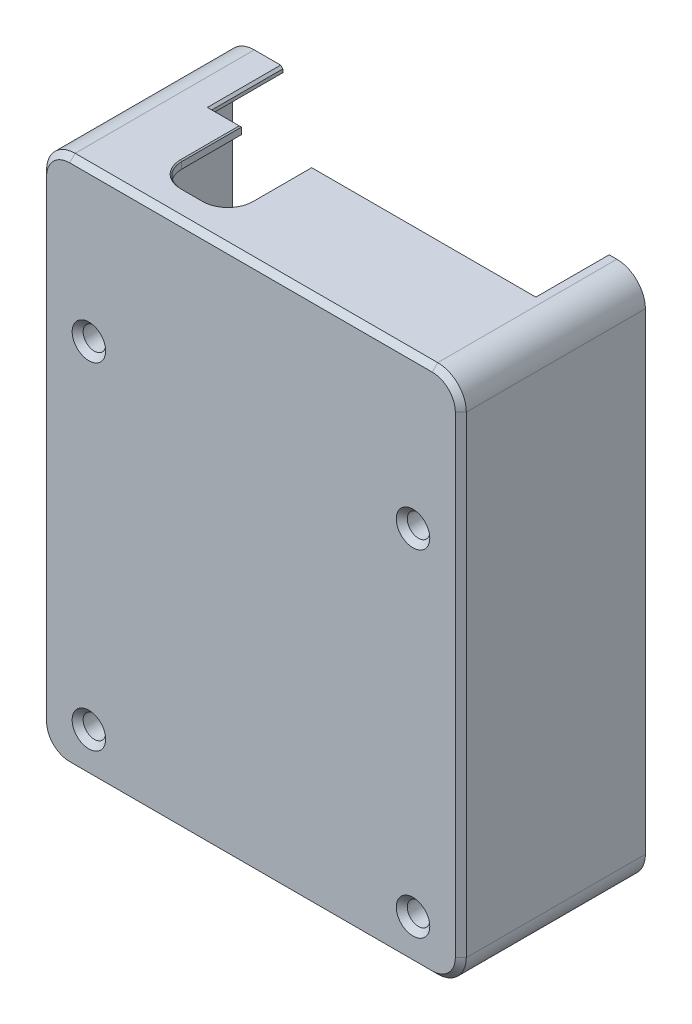
from build123d import *

# Parameters (mm, degrees)
SKETCH_1_R              = 2.25
EXTRUDE_1_DEPTH         = 13.5
EXTRUDE_1_2_DEPTH       = 13.5
EXTRUDE_1_3_DEPTH       = 13.5
EXTRUDE_2_DEPTH         = 1.57
EXTRUDE_3_DEPTH         = 0.8
EXTRUDE_4_DEPTH         = 13.5
SKETCH_19_W             = 26
SKETCH_19_H             = 14
CUT_EXTRUDE_2_DEPTH     = 1.7
SKETCH_20_W             = 29.5
SKETCH_20_H             = 10
CUT_EXTRUDE_3_DEPTH     = 4.7
MOVE_START              = 13.5
MOVE_FACE_4_DEPTH       = 0.93
EXTRUDE_5_DEPTH         = 0.7
M2_5X0_451_D            = 2.05
M2_5X0_451_CSINK_D      = 2.55
M2_5X0_451_CSINK_ANGLE  = 90
CUT_EXTRUDE_4_DEPTH     = 26
CHAMFER_5_SIZE          = 0.2
CHAMFER_1_SIZE          = 0.1
CHAMFER_2_SIZE          = 0.2
EXTRUDE_6_DEPTH         = 2.5
HOLE_WIZARD_M2_51_D     = 2.05
HOLE_WIZARD_M2_51_DEPTH = 7.25
HOLE_WIZARD_M2_51_TIP   = 0.615882135
CHAMFER_3_SIZE          = 0.5
CHAMFER_4_SIZE          = 0.5
CHAMFER_7_SIZE          = 0.2


# Read off the part's stored shape, not the designer's step: Переместить грань4
with BuildPart() as part:
    # Эскиз1 → Бобышка-Вытянуть1 (new body)
    with BuildSketch(Plane.XY):
        Circle(SKETCH_1_R)
    extrude(amount=EXTRUDE_1_DEPTH)



with BuildPart() as body_2:
    # Эскиз1 → Extrude 1 2 (new body)
    with BuildSketch(Plane.XY):
        with Locations((-29.5, 0)):
            Circle(SKETCH_1_R)
    extrude(amount=EXTRUDE_1_2_DEPTH)


with BuildPart() as body_3:
    # Эскиз1 → Extrude 1 3 (new body)
    with BuildSketch(Plane.XY):
        with Locations((-29.5, 30.6)):
            Circle(SKETCH_1_R)
    extrude(amount=EXTRUDE_1_3_DEPTH)


with BuildPart() as body_4:
    # Эскиз2 → Бобышка-Вытянуть2 (new body)
    with BuildSketch(Plane.XY.offset(-0.8)):
        with BuildLine():
            Line((-31.25, -3.9), (1.75, -3.9))
            ThreePointArc((1.75, -3.9), (3.588477631, -3.138477631), (4.35, -1.3))
            Line((4.35, -1.3), (4.35, 41.7))
            ThreePointArc((4.35, 41.7), (3.588477631, 43.538477631), (1.75, 44.3))
            Line((1.75, 44.3), (-31.25, 44.3))
            ThreePointArc((-31.25, 44.3), (-33.088477631, 43.538477631), (-33.85, 41.7))
            Line((-33.85, 41.7), (-33.85, -1.3))
            ThreePointArc((-33.85, -1.3), (-33.088477631, -3.138477631), (-31.25, -3.9))
        make_face()
        with BuildLine():
            Line((-33.15, 41.7), (-33.15, -1.3))
            ThreePointArc((-33.15, -1.3), (-32.593502884, -2.643502884), (-31.25, -3.2))
            Line((-31.25, -3.2), (1.75, -3.2))
            ThreePointArc((1.75, -3.2), (3.093502884, -2.643502884), (3.65, -1.3))
            Line((3.65, -1.3), (3.65, 41.7))
            ThreePointArc((3.65, 41.7), (3.093502884, 43.043502884), (1.75, 43.6))
            Line((1.75, 43.6), (-31.25, 43.6))
            ThreePointArc((-31.25, 43.6), (-32.593502884, 43.043502884), (-33.15, 41.7))
        make_face(mode=Mode.SUBTRACT)
    extrude(amount=-EXTRUDE_2_DEPTH)

    # Эскиз3 → Бобышка-Вытянуть3 (add)
    with BuildSketch(Plane.XY.offset(-0.8)):
        with BuildLine():
            Line((-31.25, -3.9), (1.75, -3.9))
            ThreePointArc((1.75, -3.9), (3.588477631, -3.138477631), (4.35, -1.3))
            Line((4.35, -1.3), (4.35, 41.7))
            ThreePointArc((4.35, 41.7), (3.588477631, 43.538477631), (1.75, 44.3))
            Line((1.75, 44.3), (-31.25, 44.3))
            ThreePointArc((-31.25, 44.3), (-33.088477631, 43.538477631), (-33.85, 41.7))
            Line((-33.85, 41.7), (-33.85, -1.3))
            ThreePointArc((-33.85, -1.3), (-33.088477631, -3.138477631), (-31.25, -3.9))
        make_face()
        with BuildLine():
            Line((1.75, 43.6), (-31.25, 43.6))
            ThreePointArc((-31.25, 43.6), (-32.593502884, 43.043502884), (-33.15, 41.7))
            Line((-33.15, 41.7), (-33.15, -1.3))
            ThreePointArc((-33.15, -1.3), (-32.593502884, -2.643502884), (-31.25, -3.2))
            Line((-31.25, -3.2), (1.75, -3.2))
            ThreePointArc((1.75, -3.2), (3.093502884, -2.643502884), (3.65, -1.3))
            Line((3.65, -1.3), (3.65, 41.7))
            ThreePointArc((3.65, 41.7), (3.093502884, 43.043502884), (1.75, 43.6))
        make_face(mode=Mode.SUBTRACT)
    extrude(amount=EXTRUDE_3_DEPTH)


with BuildPart() as part_1:
    add(part.part)

    add(body_2.part)  # Бобышка-Вытянуть4 merges body 2

    add(body_3.part)  # Бобышка-Вытянуть4 merges body 3

    add(body_4.part)  # Бобышка-Вытянуть4 merges body 4
    # Эскиз5 → Бобышка-Вытянуть4 (add)
    # profile 1 of 4: a face of its own
    with BuildSketch(Plane.XY):
        with BuildLine():
            ThreePointArc((-31.25, 44.3), (-33.088477631, 43.538477631), (-33.85, 41.7))
            Line((-33.85, 41.7), (-33.85, -1.3))
            ThreePointArc((-33.85, -1.3), (-33.088477631, -3.138477631), (-31.25, -3.9))
            Line((-31.25, -3.9), (1.75, -3.9))
            ThreePointArc((1.75, -3.9), (3.588477631, -3.138477631), (4.35, -1.3))
            Line((4.35, -1.3), (4.35, 41.7))
            ThreePointArc((4.35, 41.7), (3.588477631, 43.538477631), (1.75, 44.3))
            Line((1.75, 44.3), (-31.25, 44.3))
        make_face()
        with BuildLine():
            Line((-33.15, -1.3), (-33.15, 41.7))
            ThreePointArc((-33.15, 41.7), (-32.593502884, 43.043502884), (-31.25, 43.6))
            Line((-31.25, 43.6), (1.75, 43.6))
            ThreePointArc((1.75, 43.6), (3.093502884, 43.043502884), (3.65, 41.7))
            Line((3.65, 41.7), (3.65, -1.3))
            ThreePointArc((3.65, -1.3), (3.093502884, -2.643502884), (1.75, -3.2))
            Line((1.75, -3.2), (-31.25, -3.2))
            ThreePointArc((-31.25, -3.2), (-32.593502884, -2.643502884), (-33.15, -1.3))
        make_face(mode=Mode.SUBTRACT)
    # profile 2 of 4: a face of its own
    with BuildSketch(Plane.XY):
        with BuildLine():
            ThreePointArc((-31.334615385, 1.30256915), (-32.45382181, 0.928759898), (-33.15, 1.881488772))
            Line((-33.15, 1.881488772), (-33.15, -1.3))
            ThreePointArc((-33.15, -1.3), (-32.593502884, -2.643502884), (-31.25, -3.2))
            Line((-31.25, -3.2), (-27.107825257, -3.2))
            ThreePointArc((-27.107825257, -3.2), (-28.023500712, -2.601918476), (-27.843879024, -1.523076923))
            ThreePointArc((-27.843879024, -1.523076923), (-30.915639077, -1.74884705), (-31.334615385, 1.30256915))
        make_face()
    # profile 3 of 4: a face of its own
    with BuildSketch(Plane.XY):
        with BuildLine():
            ThreePointArc((-1.656120976, -1.523076923), (-1.476499288, -2.601918476), (-2.392174743, -3.2))
            Line((-2.392174743, -3.2), (1.75, -3.2))
            ThreePointArc((1.75, -3.2), (3.093502884, -2.643502884), (3.65, -1.3))
            Line((3.65, -1.3), (3.65, 1.881488772))
            ThreePointArc((3.65, 1.881488772), (2.95382181, 0.928759898), (1.834615385, 1.30256915))
            ThreePointArc((1.834615385, 1.30256915), (2.143639967, 0.683599073), (2.25, 0))
            ThreePointArc((2.25, 0), (0.817382348, -2.096279108), (-1.656120976, -1.523076923))
        make_face()
    # profile 4 of 4: a face of its own
    with BuildSketch(Plane.XY):
        with BuildLine():
            Line((-33.15, 32.481488772), (-33.15, 28.718511228))
            ThreePointArc((-33.15, 28.718511228), (-32.45382181, 29.671240102), (-31.334615385, 29.29743085))
            ThreePointArc((-31.334615385, 29.29743085), (-31.75, 30.6), (-31.334615385, 31.90256915))
            ThreePointArc((-31.334615385, 31.90256915), (-32.45382181, 31.528759898), (-33.15, 32.481488772))
        make_face()
    extrude(amount=EXTRUDE_4_DEPTH)

    # Эскиз19 → Вырез-Вытянуть2 (cut)
    with BuildSketch(Plane.XZ.offset(3.9)):
        with Locations((-14.797088434, -2.37)):
            Rectangle(SKETCH_19_W, SKETCH_19_H)
    extrude(amount=-CUT_EXTRUDE_2_DEPTH, mode=Mode.SUBTRACT)

    # Эскиз20 → Вырез-Вытянуть3 (cut)
    with BuildSketch(Plane(origin=(0, 44.3, 0), x_dir=(1, 0, 0), z_dir=(0, 1, 0))):
        with Locations((-13.899030762, 0.8)):
            Rectangle(SKETCH_20_W, SKETCH_20_H)
    extrude(amount=-CUT_EXTRUDE_3_DEPTH, mode=Mode.SUBTRACT)

    # Move Face 4 outline → Move Face 4 (add)
    with BuildSketch(Plane.XY.offset(MOVE_START)):
        with BuildLine():
            Line((-33.85, 41.7), (-33.85, -1.3))
            ThreePointArc((-33.85, -1.3), (-33.088477631, -3.138477631), (-31.25, -3.9))
            Line((-31.25, -3.9), (1.75, -3.9))
            ThreePointArc((1.75, -3.9), (3.588477631, -3.138477631), (4.35, -1.3))
            Line((4.35, -1.3), (4.35, 41.7))
            ThreePointArc((4.35, 41.7), (3.588477631, 43.538477631), (1.75, 44.3))
            Line((1.75, 44.3), (-31.25, 44.3))
            ThreePointArc((-31.25, 44.3), (-33.088477631, 43.538477631), (-33.85, 41.7))
        make_face()
        with BuildLine():
            ThreePointArc((-31.334615385, 31.90256915), (-32.45382181, 31.528759898), (-33.15, 32.481488772))
            Line((-33.15, 32.481488772), (-33.15, 41.7))
            ThreePointArc((-33.15, 41.7), (-32.593502884, 43.043502884), (-31.25, 43.6))
            Line((-31.25, 43.6), (1.75, 43.6))
            ThreePointArc((1.75, 43.6), (3.093502884, 43.043502884), (3.65, 41.7))
            Line((3.65, 41.7), (3.65, 1.881488772))
            ThreePointArc((3.65, 1.881488772), (2.95382181, 0.928759898), (1.834615385, 1.30256915))
            ThreePointArc((1.834615385, 1.30256915), (-1.415639077, 1.74884705), (-1.656120976, -1.523076923))
            ThreePointArc((-1.656120976, -1.523076923), (-1.476499288, -2.601918476), (-2.392174743, -3.2))
            Line((-2.392174743, -3.2), (-27.107825257, -3.2))
            ThreePointArc((-27.107825257, -3.2), (-28.023500712, -2.601918476), (-27.843879024, -1.523076923))
            ThreePointArc((-27.843879024, -1.523076923), (-28.084360923, 1.74884705), (-31.334615385, 1.30256915))
            ThreePointArc((-31.334615385, 1.30256915), (-32.45382181, 0.928759898), (-33.15, 1.881488772))
            Line((-33.15, 1.881488772), (-33.15, 28.718511228))
            ThreePointArc((-33.15, 28.718511228), (-32.45382181, 29.671240102), (-31.334615385, 29.29743085))
            ThreePointArc((-31.334615385, 29.29743085), (-27.25, 30.6), (-31.334615385, 31.90256915))
        make_face(mode=Mode.SUBTRACT)
    extrude(amount=MOVE_FACE_4_DEPTH)

    # Эскиз25 → Бобышка-Вытянуть5 (add)
    with BuildSketch(Plane.XY.offset(14.43)):
        with BuildLine():
            Line((-33.85, 41.7), (-33.85, -1.3))
            ThreePointArc((-33.85, -1.3), (-33.088477631, -3.138477631), (-31.25, -3.9))
            Line((-31.25, -3.9), (1.75, -3.9))
            ThreePointArc((1.75, -3.9), (3.588477631, -3.138477631), (4.35, -1.3))
            Line((4.35, -1.3), (4.35, 41.7))
            ThreePointArc((4.35, 41.7), (3.588477631, 43.538477631), (1.75, 44.3))
            Line((1.75, 44.3), (-31.25, 44.3))
            ThreePointArc((-31.25, 44.3), (-33.088477631, 43.538477631), (-33.85, 41.7))
        make_face()
    extrude(amount=-EXTRUDE_5_DEPTH)

    # Отверстие обработанное метчиком M2.5x0.451 (through all)
    with Locations(Plane(origin=(0, 0, 0), x_dir=(-1, 0, 0), z_dir=(0, 0, -1))):
        with Locations((0, 0), (29.5, 0), (29.5, 30.6)):
            CounterSinkHole(M2_5X0_451_D / 2, M2_5X0_451_CSINK_D / 2, counter_sink_angle=M2_5X0_451_CSINK_ANGLE)

    # Эскиз29 → Вырез-Вытянуть4 (cut)
    with BuildSketch(Plane(origin=(0, 44.3, 0), x_dir=(1, 0, 0), z_dir=(0, 1, 0))):
        with BuildLine():
            Line((-21.65, -11.83), (-23.65, -11.83))
            ThreePointArc((-23.65, -11.83), (-25.205634919, -11.185634919), (-25.85, -9.63))
            Line((-25.85, -9.63), (-25.85, -4.2))
            Line((-25.85, -4.2), (-19.45, -4.2))
            Line((-19.45, -4.2), (-19.45, -9.63))
            ThreePointArc((-19.45, -9.63), (-20.094365081, -11.185634919), (-21.65, -11.83))
        make_face()
    extrude(amount=-CUT_EXTRUDE_4_DEPTH, mode=Mode.SUBTRACT)

    # Фаска5
    chamfer_5_edges = [part_1.edges().sort_by_distance(p)[0] for p in [
        (-1.797088434, -3.9, 1.13),
        (-27.797088434, -3.9, 1.13),
        (-28.649030762, 43.6, 0.915),
        (0.850969238, 43.6, 0.915),
        (-28.649030762, 44.3, 0.915),
        (0.850969238, 44.3, 0.915),
    ]]
    chamfer(chamfer_5_edges, length=CHAMFER_5_SIZE)

    # Фаска1
    chamfer_1_edges = [part_1.edges().sort_by_distance(p)[0] for p in [
        (3.093502884, 43.043502884, -2.37),
        (3.65, 20.2, -2.37),
        (3.093502884, -2.643502884, -2.37),
        (-0.023544217, -3.2, -2.37),
        (1.400484619, 43.6, -2.37),
        (-29.523544217, -3.2, -2.37),
        (-32.593502884, -2.643502884, -2.37),
        (-33.15, 20.2, -2.37),
        (-32.593502884, 43.043502884, -2.37),
        (-30.049515381, 43.6, -2.37),
        (-27.349515381, 44.3, 4.2),
        (-25.85, 44.3, 6.915),
        (-25.205634919, 44.3, 11.185634919),
        (-22.65, 44.3, 11.83),
        (-20.094365081, 44.3, 11.185634919),
        (-19.45, 44.3, 6.915),
        (-9.199515381, 44.3, 4.2),
        (-14.797088434, -3.9, 4.63),
        (-27.797088434, -3.2, -1.185),
        (-1.797088434, -3.2, -1.185),
    ]]
    chamfer(chamfer_1_edges, length=CHAMFER_1_SIZE)

    # Фаска2
    # the kernel refuses this chamfer: 0.2 mm, written as the material it takes off along each edge
    with BuildSketch(Plane(origin=(-32.15, 1.881488772, 0), x_dir=(0.8153846153846122, -0.5789196222223671, 0), z_dir=(0.5789196222223671, 0.8153846153846122, 0))) as chamfer_2_piece_1_section:
        Polygon((1, -CHAMFER_2_SIZE), (1 + CHAMFER_2_SIZE, 0), (1, 0), align=None)
    chamfer_2_piece_1 = revolve(axis=Axis((-32.15, 1.881488772, 0), (0, 0, -1)), revolution_arc=174.125308708, mode=Mode.PRIVATE)
    chamfer_2_piece_1 = split(chamfer_2_piece_1, bisect_by=Plane(origin=(-33.15, 0.835809247, 0.097562569), z_dir=(1, 0, 0)), keep=Keep.TOP, mode=Mode.PRIVATE)
    add(chamfer_2_piece_1, mode=Mode.SUBTRACT)
    with BuildSketch(Plane(origin=(-32.15, 28.718511228, 0), x_dir=(-0.8703565626431264, -0.4924220282075544, 0), z_dir=(0.4924220282075544, -0.8703565626431264, 0))) as chamfer_2_piece_2_section:
        Polygon((1, -CHAMFER_2_SIZE), (1 + CHAMFER_2_SIZE, 0), (1, 0), align=None)
    chamfer_2_piece_2 = revolve(axis=Axis((-32.15, 28.718511228, 0), (0, 0, -1)), revolution_arc=174.125308708, mode=Mode.PRIVATE)
    chamfer_2_piece_2 = split(chamfer_2_piece_2, bisect_by=Plane(origin=(-33.15, 29.764190781, 0.097562571), z_dir=(1, 0, 0)), keep=Keep.TOP, mode=Mode.PRIVATE)
    add(chamfer_2_piece_2, mode=Mode.SUBTRACT)
    with BuildSketch(Plane(origin=(-32.15, 32.481488772, 0), x_dir=(0.8153846153846069, -0.5789196222223744, 0), z_dir=(0.5789196222223744, 0.8153846153846069, 0))) as chamfer_2_piece_3_section:
        Polygon((1 + CHAMFER_2_SIZE, 0), (1, -CHAMFER_2_SIZE), (1, 0), align=None)
    chamfer_2_piece_3 = revolve(axis=Axis((-32.15, 32.481488772, 0), (0, 0, -1)), revolution_arc=174.125308708, mode=Mode.PRIVATE)
    chamfer_2_piece_3 = split(chamfer_2_piece_3, bisect_by=Plane(origin=(-33.15, 31.724660289, 0.056714395), z_dir=(1, 0, 0)), keep=Keep.TOP, mode=Mode.PRIVATE)
    add(chamfer_2_piece_3, mode=Mode.SUBTRACT)
    with BuildSketch(Plane(origin=(-2.392174743, -2.2, 0), x_dir=(0.73605376700958, 0.6769230769230777, 0), z_dir=(-0.6769230769230777, 0.73605376700958, 0))) as chamfer_2_piece_4:
        Polygon((1, -CHAMFER_2_SIZE), (1 + CHAMFER_2_SIZE, 0), (1, 0), align=None)
    revolve(axis=Axis((-2.392174743, -2.2, 0), (0, 0, -1)), revolution_arc=125.567691414, mode=Mode.SUBTRACT)
    with BuildSketch(Plane(origin=(-27.107825257, -2.2, 0), x_dir=(-0.24346114137000507, -0.9699106518864582, 0), z_dir=(0.9699106518864582, -0.24346114137000507, 0))) as chamfer_2_piece_5:
        Polygon((1 + CHAMFER_2_SIZE, 0), (1, -CHAMFER_2_SIZE), (1, 0), align=None)
    revolve(axis=Axis((-27.107825257, -2.2, 0), (0, 0, -1)), revolution_arc=118.512756614, mode=Mode.SUBTRACT)
    with BuildSketch(Plane(origin=(0, 0, 0), x_dir=(0.8153846153846158, 0.5789196222223618, 0), z_dir=(0.5789196222223618, -0.8153846153846158, 0))) as chamfer_2_piece_6:
        Polygon((2.25, CHAMFER_2_SIZE), (2.25 - CHAMFER_2_SIZE, 0), (2.25, 0), align=None)
    revolve(axis=Axis((0, 0, 0), (0, 0, 1)), revolution_arc=187.229076359, mode=Mode.SUBTRACT)
    with BuildSketch(Plane(origin=(2.65, 1.881488772, 0), x_dir=(0.8703565626431259, 0.4924220282075555, 0), z_dir=(-0.4924220282075555, 0.8703565626431259, 0))) as chamfer_2_piece_7_section:
        Polygon((1, -CHAMFER_2_SIZE), (1 + CHAMFER_2_SIZE, 0), (1, 0), align=None)
    chamfer_2_piece_7 = revolve(axis=Axis((2.65, 1.881488772, 0), (0, 0, -1)), revolution_arc=174.125308708, mode=Mode.PRIVATE)
    chamfer_2_piece_7 = split(chamfer_2_piece_7, bisect_by=Plane(origin=(3.65, 0.835809234, 0.097562579), z_dir=(-1, 0, 0)), keep=Keep.TOP, mode=Mode.PRIVATE)
    add(chamfer_2_piece_7, mode=Mode.SUBTRACT)
    with BuildSketch(Plane(origin=(-29.5, 0, 0), x_dir=(0.7360537670095794, -0.6769230769230783, 0), z_dir=(-0.6769230769230783, -0.7360537670095794, 0))) as chamfer_2_piece_8:
        Polygon((2.25, CHAMFER_2_SIZE), (2.25 - CHAMFER_2_SIZE, 0), (2.25, 0), align=None)
    revolve(axis=Axis((-29.5, 0, 0), (0, 0, 1)), revolution_arc=187.229076359, mode=Mode.SUBTRACT)
    with BuildSketch(Plane(origin=(-29.5, 30.6, 0), x_dir=(-0.8153846153846124, -0.5789196222223667, 0), z_dir=(-0.5789196222223667, 0.8153846153846124, 0))) as chamfer_2_piece_9:
        Polygon((2.25, CHAMFER_2_SIZE), (2.25 - CHAMFER_2_SIZE, 0), (2.25, 0), align=None)
    revolve(axis=Axis((-29.5, 30.6, 0), (0, 0, 1)), revolution_arc=289.250819106, mode=Mode.SUBTRACT)

    # Эскиз26 → Бобышка-Вытянуть6 (add)
    with BuildSketch(Plane(origin=(0, 0, 13.73), x_dir=(-1, 0, 0), z_dir=(0, 0, -1))):
        with BuildLine():
            Line((-3.65, 32.481488772), (-3.65, 28.718511228))
            ThreePointArc((-3.65, 28.718511228), (-2.95382181, 29.671240102), (-1.834615385, 29.29743085))
            ThreePointArc((-1.834615385, 29.29743085), (2.25, 30.6), (-1.834615385, 31.90256915))
            ThreePointArc((-1.834615385, 31.90256915), (-2.95382181, 31.528759898), (-3.65, 32.481488772))
        make_face()
    extrude(amount=EXTRUDE_6_DEPTH)

    # Отверстие обработанное метчиком M2.51
    with Locations(Plane.XY.offset(14.43)):
        with Locations((0, 30.6)):
            Hole(HOLE_WIZARD_M2_51_D / 2, depth=HOLE_WIZARD_M2_51_DEPTH)
            with Locations((0, 0, -(HOLE_WIZARD_M2_51_DEPTH + HOLE_WIZARD_M2_51_TIP / 2))):  # 118° drill point
                Cone(0, HOLE_WIZARD_M2_51_D / 2, HOLE_WIZARD_M2_51_TIP, mode=Mode.SUBTRACT)

    # Фаска3
    chamfer_3_edges = [part_1.edges().sort_by_distance(p)[0] for p in [
        (-30.525, 30.6, 14.43),
        (-30.525, 0, 14.43),
        (-1.025, 0, 14.43),
        (1.025, 30.6, 14.43),
    ]]
    chamfer(chamfer_3_edges, length=CHAMFER_3_SIZE)

    # Фаска4
    chamfer_4_edges = [part_1.edges().sort_by_distance(p)[0] for p in [
        (-33.088477631, 43.538477631, 14.43),
        (-33.85, 20.2, 14.43),
        (-33.088477631, -3.138477631, 14.43),
        (-14.75, -3.9, 14.43),
        (3.588477631, -3.138477631, 14.43),
        (4.35, 20.2, 14.43),
        (3.588477631, 43.538477631, 14.43),
        (-14.75, 44.3, 14.43),
    ]]
    chamfer(chamfer_4_edges, length=CHAMFER_4_SIZE)

    # Фаска7
    chamfer_7_edges = [part_1.edges().sort_by_distance(p)[0] for p in [
        (2.95382181, 29.671240102, 11.23),
        (-2.25, 30.6, 11.23),
        (2.95382181, 31.528759898, 11.23),
    ]]
    chamfer(chamfer_7_edges, length=CHAMFER_7_SIZE)


solid = part_1.part
